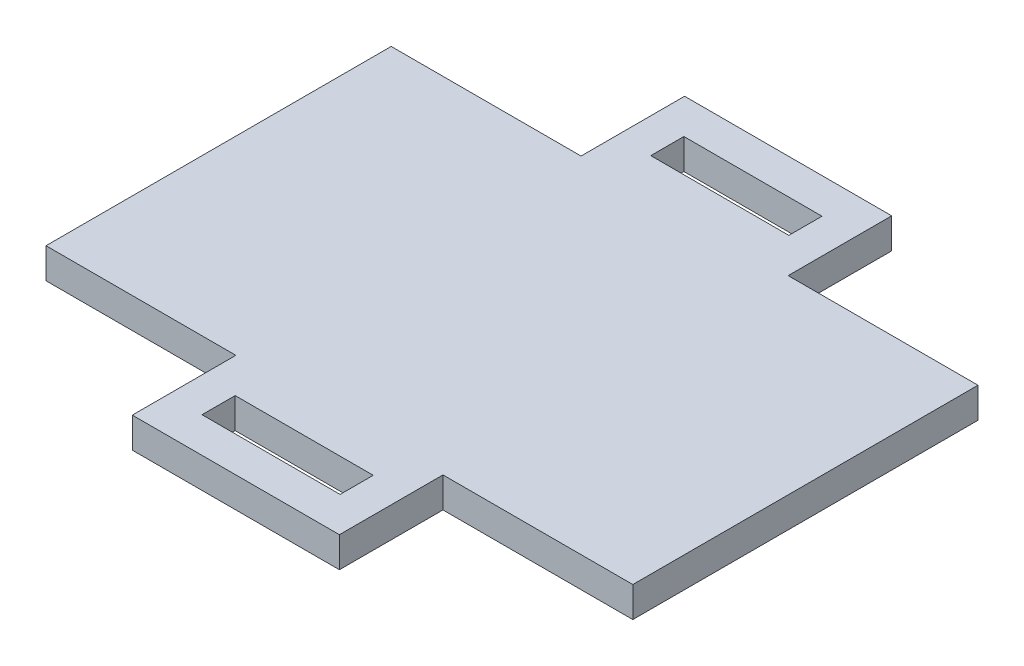
from build123d import *

# Parameters (mm, degrees)
BOSS_EXTRUDE1_DEPTH = 5.588
SKETCH2_W           = 25.4
SKETCH2_H           = 6.096
CUT_EXTRUDE1_DEPTH  = 75.331462847


with BuildPart() as part:
    # Sketch1 → Boss-Extrude1 (new body)
    with BuildSketch(Plane(origin=(0, 0, 0), x_dir=(1, 0, 0), z_dir=(0, 1, 0))):
        Polygon((19.05, 31.75), (19.05, 50.8), (-19.05, 50.8), (-19.05, 31.75), (-53.975, 31.75), (-53.975, -31.75), (-19.05, -31.75), (-19.05, -50.8), (19.05, -50.8), (19.05, -31.75), (53.975, -31.75), (53.975, 31.75), align=None)
    extrude(amount=BOSS_EXTRUDE1_DEPTH)

    # Sketch2 → Cut-Extrude1 (cut, through all)
    with BuildSketch(Plane(origin=(0, 5.588, 0), x_dir=(1, 0, 0), z_dir=(0, 1, 0))):
        with Locations((0, 41.275)):
            Rectangle(SKETCH2_W, SKETCH2_H)
        with Locations((0, -41.275)):
            Rectangle(SKETCH2_W, SKETCH2_H)
    extrude(amount=-CUT_EXTRUDE1_DEPTH, mode=Mode.SUBTRACT)


solid = part.part
